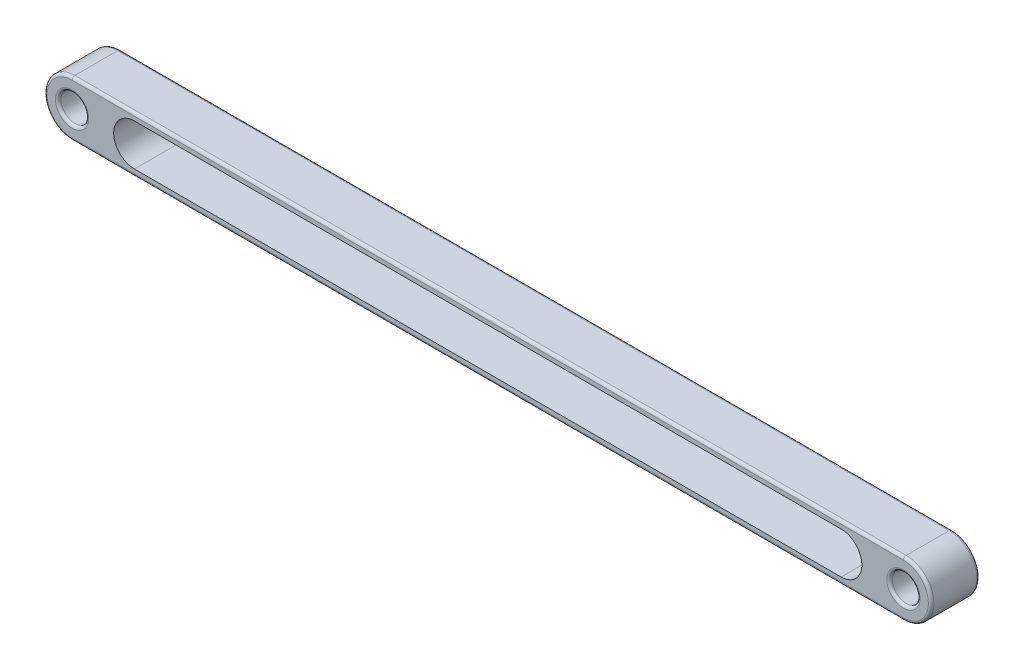
from build123d import *

# Parameters (mm, degrees)
BOSS_EXTRUDE2_DEPTH = 17.5
SKETCH5_R           = 10
CUT_EXTRUDE1_DEPTH  = 323.529068457
CUT_EXTRUDE2_DEPTH  = 40
FILLET1_R           = 2


with BuildPart() as part:
    # Sketch4 → Boss-Extrude2 (new, symmetric)
    with BuildSketch(Plane.XY):
        with BuildLine():
            Line((-300, 20), (300, 20))
            ThreePointArc((300, 20), (320, 0), (300, -20))
            Line((300, -20), (-300, -20))
            ThreePointArc((-300, -20), (-320, 0), (-300, 20))
        make_face()
    extrude(amount=BOSS_EXTRUDE2_DEPTH, both=True)

    # Sketch5 → Cut-Extrude1 (cut, through all)
    with BuildSketch(Plane.XY.offset(17.5)):
        with Locations((300, 0)):
            Circle(SKETCH5_R)
        with Locations((-300, 0)):
            Circle(SKETCH5_R)
    extrude(amount=-CUT_EXTRUDE1_DEPTH, mode=Mode.SUBTRACT)

    # Sketch6 → Cut-Extrude2 (cut)
    with BuildSketch(Plane(origin=(0, 0, -17.5), x_dir=(-1, 0, 0), z_dir=(0, 0, -1))):
        with BuildLine():
            Line((-255, 15), (255, 15))
            ThreePointArc((255, 15), (270, 0), (255, -15))
            Line((255, -15), (-255, -15))
            ThreePointArc((-255, -15), (-270, 0), (-255, 15))
        make_face()
    extrude(amount=-CUT_EXTRUDE2_DEPTH, mode=Mode.SUBTRACT)

    # Fillet1
    fillet1_edges = [part.edges().sort_by_distance(p)[0] for p in [
        (320, 0, 17.5),
        (0, -20, 17.5),
        (-320, 0, 17.5),
        (320, 0, -17.5),
        (0, -20, -17.5),
        (-320, 0, -17.5),
        (0, 20, 17.5),
        (0, 20, -17.5),
        (290, 0, 17.5),
        (290, 0, -17.5),
        (-310, 0, 17.5),
        (-310, 0, -17.5),
    ]]
    fillet(fillet1_edges, radius=FILLET1_R)


solid = part.part
